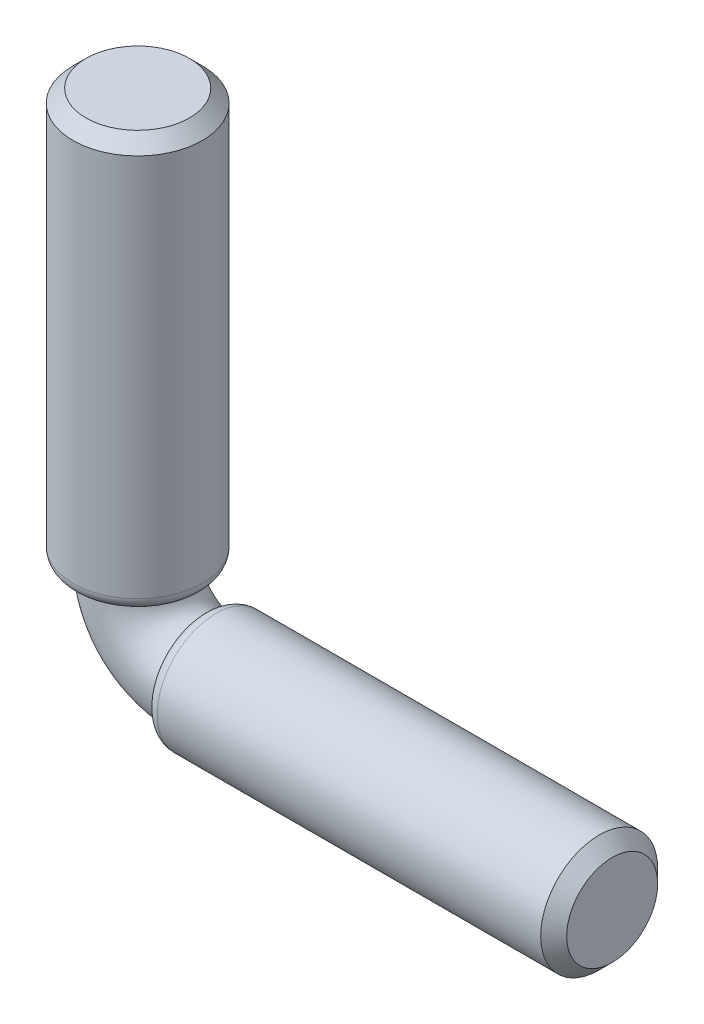
from build123d import *

# Parameters (mm, degrees)
SWEEP1_PROFILE_R    = 3.5
SKETCH10_R          = 4.975547708
BOSS_EXTRUDE1_DEPTH = 31.5
SKETCH11_R          = 4.5
BOSS_EXTRUDE2_DEPTH = 31.5
CHAMFER1_SIZE       = 1
CHAMFER2_SIZE       = 1
FILLET3_R           = 1


with BuildPart() as part:
    # Sweep1: sweep along a path in Sketch1
    with BuildLine(Plane.XY) as sweep1_path:
        Line((0, 31.5), (0, 0))
        ThreePointArc((0, 0), (1.464466094, -3.535533906), (5, -5))
        Line((5, -5), (36.5, -5))
    # Sweep1 profile (on start of the path) → Sweep1 (sweep)
    with BuildSketch(Plane(origin=(0, 31.5, 0), x_dir=(-1, 0, 0), z_dir=(0, -1, 0))):
        Circle(SWEEP1_PROFILE_R)
    sweep(path=sweep1_path.line)

    # Sketch10 → Boss-Extrude1 (add)
    with BuildSketch(Plane(origin=(0, 31.5, 0), x_dir=(1, 0, 0), z_dir=(0, 1, 0))):
        with Locations(Location((0, 0, 0), (0, 0, 180))):
            Circle(SKETCH10_R)
    extrude(amount=-BOSS_EXTRUDE1_DEPTH)

    # Sketch11 → Boss-Extrude2 (add)
    with BuildSketch(Plane(origin=(36.5, 0, 0), x_dir=(0, 0, -1), z_dir=(1, 0, 0))):
        with Locations((0, -5)):
            Circle(SKETCH11_R)
    extrude(amount=-BOSS_EXTRUDE2_DEPTH)

    # Chamfer1
    chamfer1_edges = [part.edges().sort_by_distance(p)[0] for p in [
        (4.975547708, 31.5, 0),
    ]]
    chamfer(chamfer1_edges, length=CHAMFER1_SIZE)

    # Chamfer2
    chamfer2_edges = [part.edges().sort_by_distance(p)[0] for p in [
        (36.5, -5, 4.5),
    ]]
    chamfer(chamfer2_edges, length=CHAMFER2_SIZE)

    # Fillet3
    fillet3_edges = [part.edges().sort_by_distance(p)[0] for p in [
        (5, -5, 4.5),
        (4.975547708, 0, 0),
    ]]
    fillet(fillet3_edges, radius=FILLET3_R - 0.0001)  # a hair under: the kernel refuses the full size


solid = part.part
